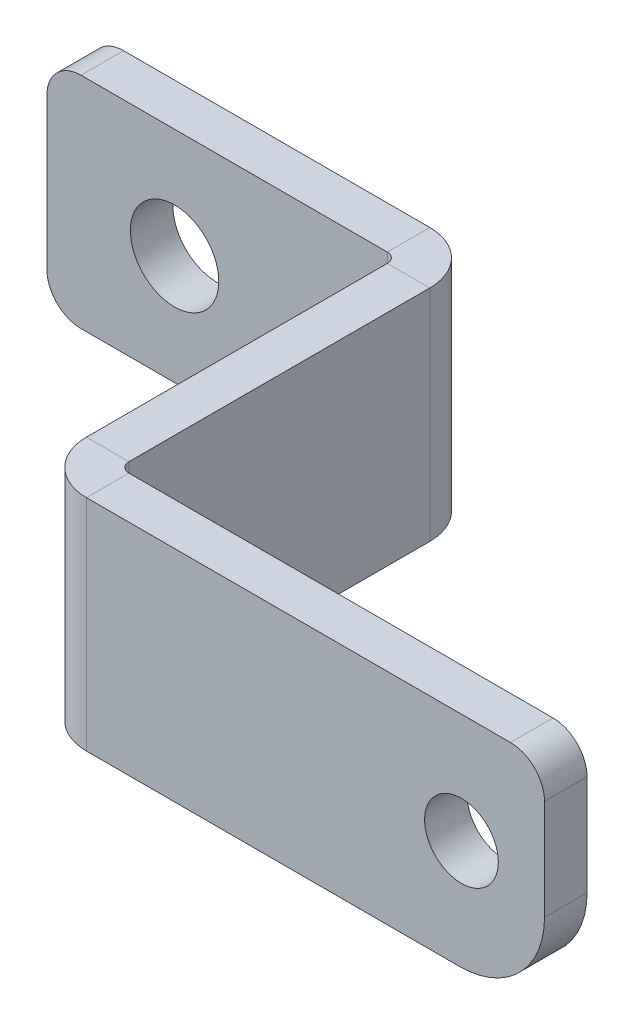
from build123d import *

# Parameters (mm, degrees)
BASE_FLANGE1_DEPTH           = 3.175
M6_CLEARANCE_HOLE1_D         = 6.6
EDGE_FLANGE1_DEPTH           = 16.378
EDGE_FLANGE2_STRIP_W         = 14.1732
EDGE_FLANGE2_STRIP_H         = 3.175
EDGE_FLANGE2_STRIP_CUT_DEPTH = 16.378
EDGE_FLANGE2_DEPTH           = 16.378
M5_CLEARANCE_HOLE1_D         = 5.5
FILLET1_R                    = 2.54
FILLET2_R                    = 6.35


# Sheet-metal steps are written as plain solids
with BuildPart() as part:
    # Sketch1 → Base-Flange1 (new body)
    with BuildSketch(Plane.XY):
        Polygon((52.8905, -45.562600001), (36.5125, -45.562600001), (36.5125, -29.184600001), (61.9125, -29.184600001), (61.9125, -45.562600001), align=None)
    extrude(amount=-BASE_FLANGE1_DEPTH)

    # M6 Clearance Hole1 (through all)
    with Locations(Plane.XY):
        with Locations((46.0375, -37.373600001)):
            Hole(M6_CLEARANCE_HOLE1_D / 2)

    # Edge-Flange1 section (across the edge) → Edge-Flange1 (add)
    with BuildSketch(Plane(origin=(62.6491, -45.562600001, 0), x_dir=(-1, 0, 0), z_dir=(0, 1, 0))):
        with BuildLine():
            Line((-3.175, 0.7366), (-3.175, 23.9268))
            Line((-3.175, 23.9268), (0, 23.9268))
            Line((0, 23.9268), (0, 0.7366))
            ThreePointArc((0, 0.7366), (0.215745145, 0.215745145), (0.7366, 0))
            Line((0.7366, 0), (0.7366, -3.175))
            ThreePointArc((0.7366, -3.175), (-2.029318885, -2.029318885), (-3.175, 0.7366))
        make_face()
    extrude(amount=EDGE_FLANGE1_DEPTH)

    # Edge-Flange2 strip (across the edge) → Edge-Flange2 strip cut (cut)
    with BuildSketch(Plane(origin=(65.8241, -29.184600001, 23.9268), x_dir=(0, 0, -1), z_dir=(0, -1, 0))):
        with Locations((-6.35, -1.5875)):
            Rectangle(EDGE_FLANGE2_STRIP_W, EDGE_FLANGE2_STRIP_H)
    extrude(amount=EDGE_FLANGE2_STRIP_CUT_DEPTH, mode=Mode.SUBTRACT)

    # Edge-Flange2 section (across the edge) → Edge-Flange2 (add)
    with BuildSketch(Plane(origin=(65.8241, -29.184600001, 23.9268), x_dir=(0, 0, -1), z_dir=(0, -1, 0))):
        with BuildLine():
            Line((-3.175, 0.7366), (-3.175, 34.925))
            Line((-3.175, 34.925), (0, 34.925))
            Line((0, 34.925), (0, 0.7366))
            ThreePointArc((0, 0.7366), (0.215745145, 0.215745145), (0.7366, 0))
            Line((0.7366, 0), (0.7366, -3.175))
            ThreePointArc((0.7366, -3.175), (-2.029318885, -2.029318885), (-3.175, 0.7366))
        make_face()
    extrude(amount=EDGE_FLANGE2_DEPTH)

    # M5 Clearance Hole1 (through all)
    with Locations(Plane.XY.offset(27.1018)):
        with Locations((94.5499, -37.373600001)):
            Hole(M5_CLEARANCE_HOLE1_D / 2)

    # Fillet1
    fillet1_edges = [part.edges().sort_by_distance(p)[0] for p in [
        (100.7491, -29.184600001, 25.5143),
        (36.5125, -45.562600001, -1.5875),
        (36.5125, -29.184600001, -1.5875),
    ]]
    fillet(fillet1_edges, radius=FILLET1_R)

    # Fillet2
    fillet2_edges = [part.edges().sort_by_distance(p)[0] for p in [
        (100.7491, -45.562600001, 25.5143),
    ]]
    fillet(fillet2_edges, radius=FILLET2_R)


solid = part.part
